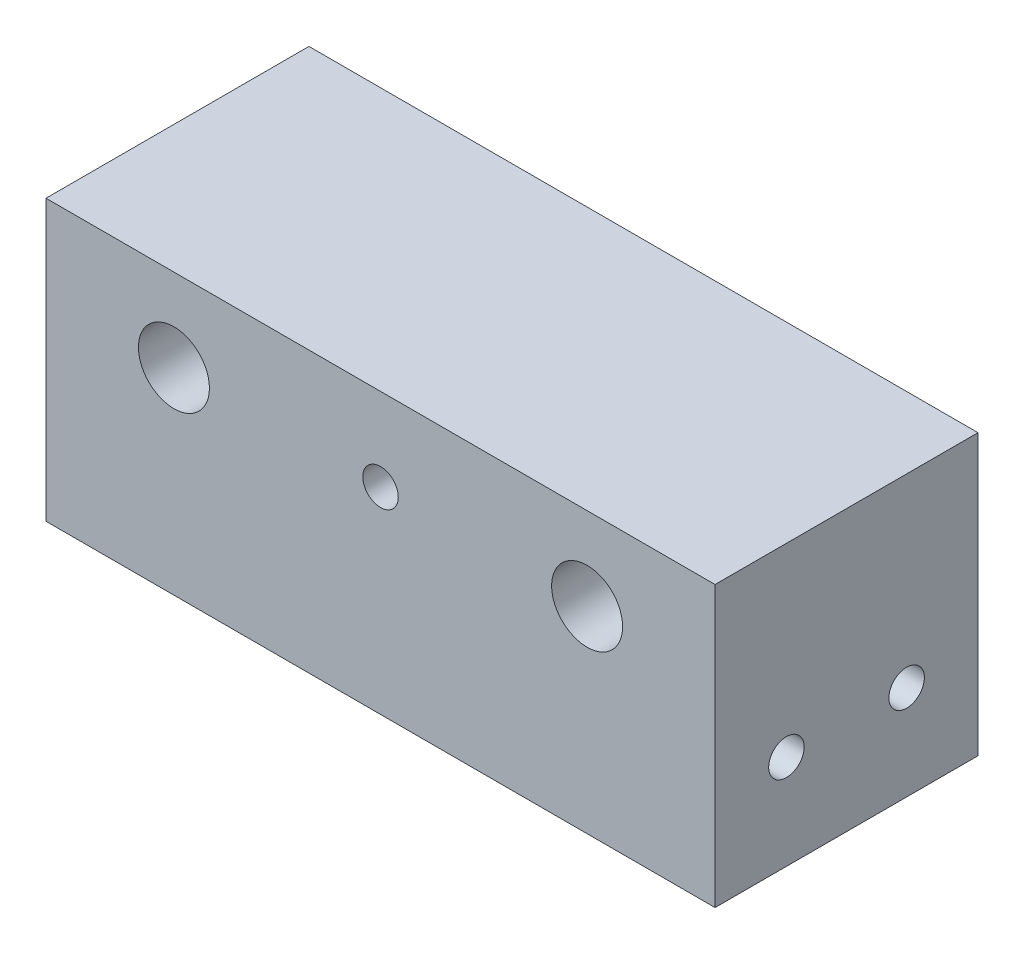
from build123d import *

# Parameters (mm, degrees)
SKETCH1_W           = 56.55
SKETCH1_H           = 22.225
BOSS_EXTRUDE1_DEPTH = 22.225
SKETCH2_R           = 3
SKETCH2_R_2         = 1.5
CUT_EXTRUDE1_DEPTH  = 10
SKETCH3_R           = 1.5
CUT_EXTRUDE2_DEPTH  = 10
SKETCH5_W           = 56.55
SKETCH5_H           = 22.225
BOSS_EXTRUDE2_DEPTH = 1.42494
SKETCH6_R           = 3.025
CUT_EXTRUDE3_DEPTH  = 10


with BuildPart() as part:
    # Sketch1 → Boss-Extrude1 (new body)
    with BuildSketch(Plane.XY):
        Rectangle(SKETCH1_W, SKETCH1_H)
    extrude(amount=BOSS_EXTRUDE1_DEPTH)

    # Sketch2 → Cut-Extrude1 (cut)
    with BuildSketch(Plane.XY.offset(22.225)):
        with Locations((17.4625, 4.1125)):
            Circle(SKETCH2_R)
        with Locations((-17.4625, 4.1125)):
            Circle(SKETCH2_R)
        with Locations((0, 4.1125)):
            Circle(SKETCH2_R_2)
    extrude(amount=-CUT_EXTRUDE1_DEPTH, mode=Mode.SUBTRACT)

    # Sketch3 → Cut-Extrude2 (cut)
    with BuildSketch(Plane.ZY.offset(28.275)):
        with Locations((16.1925, -4.5375001)):
            Circle(SKETCH3_R)
        with Locations((6.0325, -4.5375001)):
            Circle(SKETCH3_R)
    cut_extrude2 = extrude(amount=-CUT_EXTRUDE2_DEPTH, mode=Mode.SUBTRACT)

    # Sketch5 → Boss-Extrude2 (add)
    with BuildSketch(Plane.XZ.offset(11.1125)):
        with Locations((0, 11.1125)):
            Rectangle(SKETCH5_W, SKETCH5_H)
    extrude(amount=BOSS_EXTRUDE2_DEPTH)

    # Sketch6 → Cut-Extrude3 (cut)
    with BuildSketch(Plane(origin=(0, 0, 0), x_dir=(-1, 0, 0), z_dir=(0, 0, -1))):
        Circle(SKETCH6_R)
    extrude(amount=-CUT_EXTRUDE3_DEPTH, mode=Mode.SUBTRACT)

    # Mirror2: Cut-Extrude2 across plane
    add(cut_extrude2.mirror(Plane(origin=(0, 0, 0), x_dir=(0, 0, 1), z_dir=(1, 0, 0))), mode=Mode.SUBTRACT)


solid = part.part
